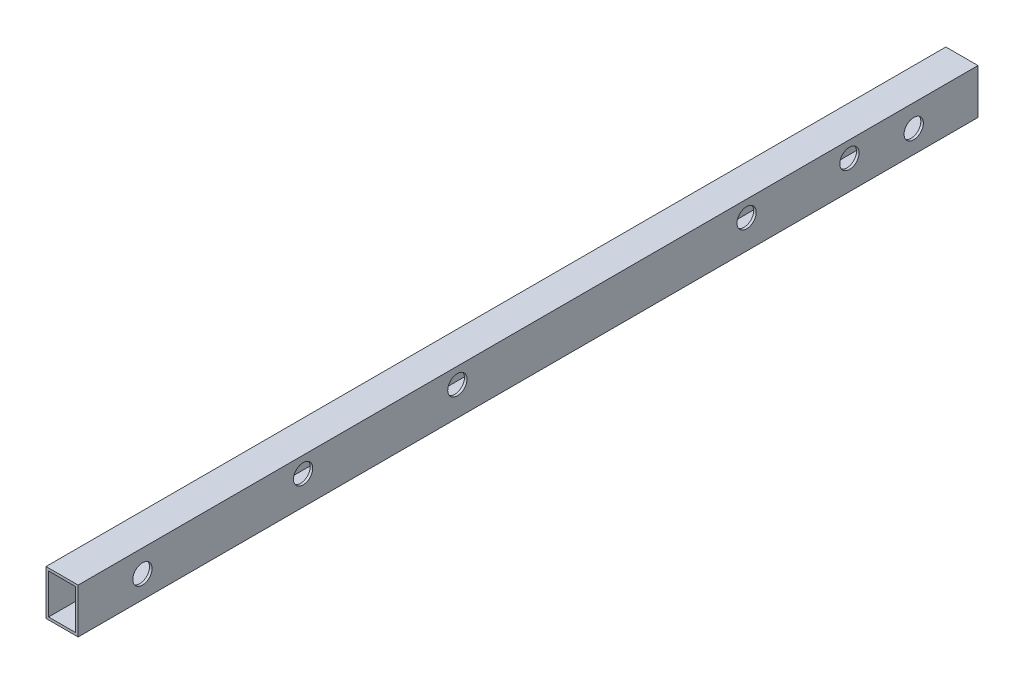
from build123d import *

# Parameters (mm, degrees)
SKETCH1_W           = 50
SKETCH1_H           = 70
SKETCH1_W_2         = 42
SKETCH1_H_2         = 62
BOSS_EXTRUDE2_DEPTH = 1400
SKETCH2_R           = 15
CUT_EXTRUDE1_DEPTH  = 1403.640367307
SKETCH3_R           = 15
CUT_EXTRUDE2_DEPTH  = 1403.640367307


with BuildPart() as part:
    # Sketch1 → Boss-Extrude2 (new body)
    with BuildSketch(Plane.XY):
        with Locations((25, -35)):
            Rectangle(SKETCH1_W, SKETCH1_H)
        with Locations((25, -35)):
            Rectangle(SKETCH1_W_2, SKETCH1_H_2, mode=Mode.SUBTRACT)
    extrude(amount=BOSS_EXTRUDE2_DEPTH)

    # Sketch2 → Cut-Extrude1 (cut, through all)
    with BuildSketch(Plane(origin=(50, 0, 0), x_dir=(0, 0, -1), z_dir=(1, 0, 0))):
        with Locations((-1050, -25)):
            Circle(SKETCH2_R)
        with Locations((-200, -25)):
            Circle(SKETCH2_R)
        with Locations((-810, -25)):
            Circle(SKETCH2_R)
        with Locations((-360, -25)):
            Circle(SKETCH2_R)
    extrude(amount=-CUT_EXTRUDE1_DEPTH, mode=Mode.SUBTRACT)

    # Sketch3 → Cut-Extrude2 (cut, through all)
    with BuildSketch(Plane(origin=(50, 0, 0), x_dir=(0, 0, -1), z_dir=(1, 0, 0))):
        with Locations((-1300, -35)):
            Circle(SKETCH3_R)
        with Locations((-100, -35)):
            Circle(SKETCH3_R)
    extrude(amount=-CUT_EXTRUDE2_DEPTH, mode=Mode.SUBTRACT)


solid = part.part
